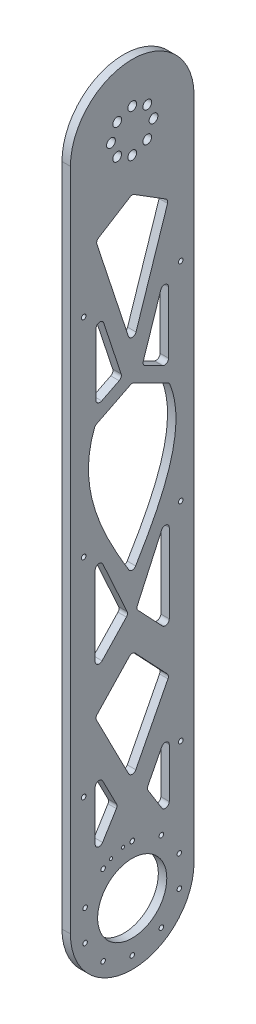
from build123d import *

# Parameters (mm, degrees)
SKETCH1_R           = 3.3
SKETCH1_R_2         = 1.7
SKETCH1_R_3         = 26
BOSS_EXTRUDE1_DEPTH = 6.35
CUT_EXTRUDE1_DEPTH  = 549.511460682
FILLET1_R           = 3
SKETCH4_R           = 1.75
CUT_EXTRUDE2_DEPTH  = 549.511460792
SKETCH5_R           = 1.2
CUT_EXTRUDE4_DEPTH  = 549.511460792


with BuildPart() as part:
    # Sketch1 → Boss-Extrude1 (new body)
    with BuildSketch(Plane(origin=(0, 0, 0), x_dir=(0, -1, 0), z_dir=(1, 0, 0))):
        with BuildLine():
            Line((500, 46.5), (0, 46.5))
            ThreePointArc((0, 46.5), (-46.5, 0), (0, -46.5))
            Line((0, -46.5), (500, -46.5))
            ThreePointArc((500, -46.5), (546.5, 0), (500, 46.5))
        make_face()
        with Locations((0, -16)):
            Circle(SKETCH1_R, mode=Mode.SUBTRACT)
        with Locations((-11.313708499, -11.313708499)):
            Circle(SKETCH1_R, mode=Mode.SUBTRACT)
        with Locations((11.313708499, -11.313708499)):
            Circle(SKETCH1_R, mode=Mode.SUBTRACT)
        with Locations((16, 0)):
            Circle(SKETCH1_R, mode=Mode.SUBTRACT)
        with Locations((488.48911696, -35.426855232)):
            Circle(SKETCH1_R_2, mode=Mode.SUBTRACT)
        with Locations((511.51088304, -35.426855232)):
            Circle(SKETCH1_R_2, mode=Mode.SUBTRACT)
        with Locations((469.86411696, -21.895000648)):
            Circle(SKETCH1_R_2, mode=Mode.SUBTRACT)
        with Locations((530.13588304, -21.895000648)):
            Circle(SKETCH1_R_2, mode=Mode.SUBTRACT)
        with Locations((462.75, 0)):
            Circle(SKETCH1_R_2, mode=Mode.SUBTRACT)
        with Locations((-16, 0)):
            Circle(SKETCH1_R, mode=Mode.SUBTRACT)
        with Locations((-11.313708499, 11.313708499)):
            Circle(SKETCH1_R, mode=Mode.SUBTRACT)
        with Locations((11.313708499, 11.313708499)):
            Circle(SKETCH1_R, mode=Mode.SUBTRACT)
        with Locations((0, 16)):
            Circle(SKETCH1_R, mode=Mode.SUBTRACT)
        with Locations((500, 0)):
            Circle(SKETCH1_R_3, mode=Mode.SUBTRACT)
        with Locations((537.25, 0)):
            Circle(SKETCH1_R_2, mode=Mode.SUBTRACT)
        with Locations((469.86411696, 21.895000648)):
            Circle(SKETCH1_R_2, mode=Mode.SUBTRACT)
        with Locations((530.13588304, 21.895000648)):
            Circle(SKETCH1_R_2, mode=Mode.SUBTRACT)
        with Locations((488.48911696, 35.426855232)):
            Circle(SKETCH1_R_2, mode=Mode.SUBTRACT)
        with Locations((511.51088304, 35.426855232)):
            Circle(SKETCH1_R_2, mode=Mode.SUBTRACT)
    extrude(amount=BOSS_EXTRUDE1_DEPTH)

    # Sketch3 → Cut-Extrude1 (cut, through all)
    with BuildSketch(Plane(origin=(6.35, 0, 0), x_dir=(0, 0, -1), z_dir=(1, 0, 0))):
        Polygon((0, -422.848022722), (27.858212922, -368.632839363), (0, -339.139268075), (-27.858212922, -368.632839363), align=None)
        Polygon((0, -41.368651369), (-27.312924288, -58.435222232), (0, -141.248998295), (27.312924288, -58.435222232), align=None)
        Polygon((3, -313.189087212), (27.858212922, -339.506549748), (27.858212922, -258.646044282), align=None)
        Polygon((-27.858212922, -339.506549748), (-27.858212922, -258.646044282), (-3, -313.189087212), align=None)
        Polygon((-27.858212922, -401.452857349), (-11, -434.260816252), (-27.858212922, -461.481824785), align=None)
        Polygon((11, -434.260816252), (27.858212922, -461.481824785), (27.858212922, -401.452857349), align=None)
        with BuildLine():
            Line((0, -164.248853344), (-27.858212922, -178.200474573))
            add(Edge.make_bspline(
                [(-27.858212922, -178.200474573), (-43.7790539, -216.093343216), (-18.61661693, -258.276071598), (0, -289.085024731)],
                knots=[0, 0, 0, 0, 1, 1, 1, 1], degree=3))
            add(Edge.make_bspline(
                [(27.858212922, -178.200474573), (43.7790539, -216.093343216), (18.61661693, -258.276071598), (0, -289.085024731)],
                knots=[0, 0, 0, 0, 1, 1, 1, 1], degree=3))
            Line((27.858212922, -178.200474573), (0, -164.248853344))
        make_face()
        Polygon((7.5, -156.820958214), (27.312924288, -96.747453897), (27.312924288, -166.743432993), align=None)
        Polygon((-27.312924288, -96.747453897), (-27.312924288, -166.743432993), (-7.5, -156.820958214), align=None)
    extrude(amount=-CUT_EXTRUDE1_DEPTH, mode=Mode.SUBTRACT)

    # Fillet1
    fillet1_edges = [part.edges().sort_by_distance(p)[0] for p in [
        (3.175, -58.435222232, -27.312924288),
        (3.175, -41.368651369, 0),
        (3.175, -58.435222232, 27.312924288),
        (3.175, -141.248998295, 0),
        (3.175, -289.085024731, 0),
        (3.175, -164.248853344, 0),
        (3.175, -401.452857349, 27.858212922),
        (3.175, -434.260816252, 11),
        (3.175, -461.481824785, 27.858212922),
        (3.175, -461.481824785, -27.858212922),
        (3.175, -434.260816252, -11),
        (3.175, -401.452857349, -27.858212922),
        (3.175, -368.632839363, -27.858212922),
        (3.175, -339.139268075, 0),
        (3.175, -368.632839363, 27.858212922),
        (3.175, -422.848022722, 0),
        (3.175, -313.189087212, 3),
        (3.175, -339.506549748, 27.858212922),
        (3.175, -258.646044282, 27.858212922),
        (3.175, -178.200474573, -27.858212922),
        (3.175, -178.200474573, 27.858212922),
        (3.175, -339.506549748, -27.858212922),
        (3.175, -313.189087212, -3),
        (3.175, -258.646044282, -27.858212922),
        (3.175, -96.747453897, 27.312924288),
        (3.175, -166.743432993, 27.312924288),
        (3.175, -156.820958214, 7.5),
        (3.175, -166.743432993, -27.312924288),
        (3.175, -156.820958214, -7.5),
        (3.175, -96.747453897, -27.312924288),
    ]]
    fillet(fillet1_edges, radius=FILLET1_R)

    # Sketch4 → Cut-Extrude2 (cut, through all)
    with BuildSketch(Plane(origin=(6.35, 0, 0), x_dir=(0, 0, -1), z_dir=(1, 0, 0))):
        with Locations((-36.5, -103.175)):
            Circle(SKETCH4_R)
        with Locations((36.5, -103.175)):
            Circle(SKETCH4_R)
        with Locations((-36.5, -259.525)):
            Circle(SKETCH4_R)
        with Locations((36.5, -259.525)):
            Circle(SKETCH4_R)
        with Locations((-36.5, -415.875)):
            Circle(SKETCH4_R)
        with Locations((36.5, -415.875)):
            Circle(SKETCH4_R)
    extrude(amount=-CUT_EXTRUDE2_DEPTH, mode=Mode.SUBTRACT)

    # Sketch5 → Cut-Extrude4 (cut, through all)
    with BuildSketch(Plane(origin=(6.35, 0, 0), x_dir=(0, 0, -1), z_dir=(1, 0, 0))):
        with Locations((-6.916110339, -463.343078174)):
            Circle(SKETCH5_R)
        with Locations((-15.951147244, -466.27873962)):
            Circle(SKETCH5_R)
    extrude(amount=-CUT_EXTRUDE4_DEPTH, mode=Mode.SUBTRACT)


solid = part.part
